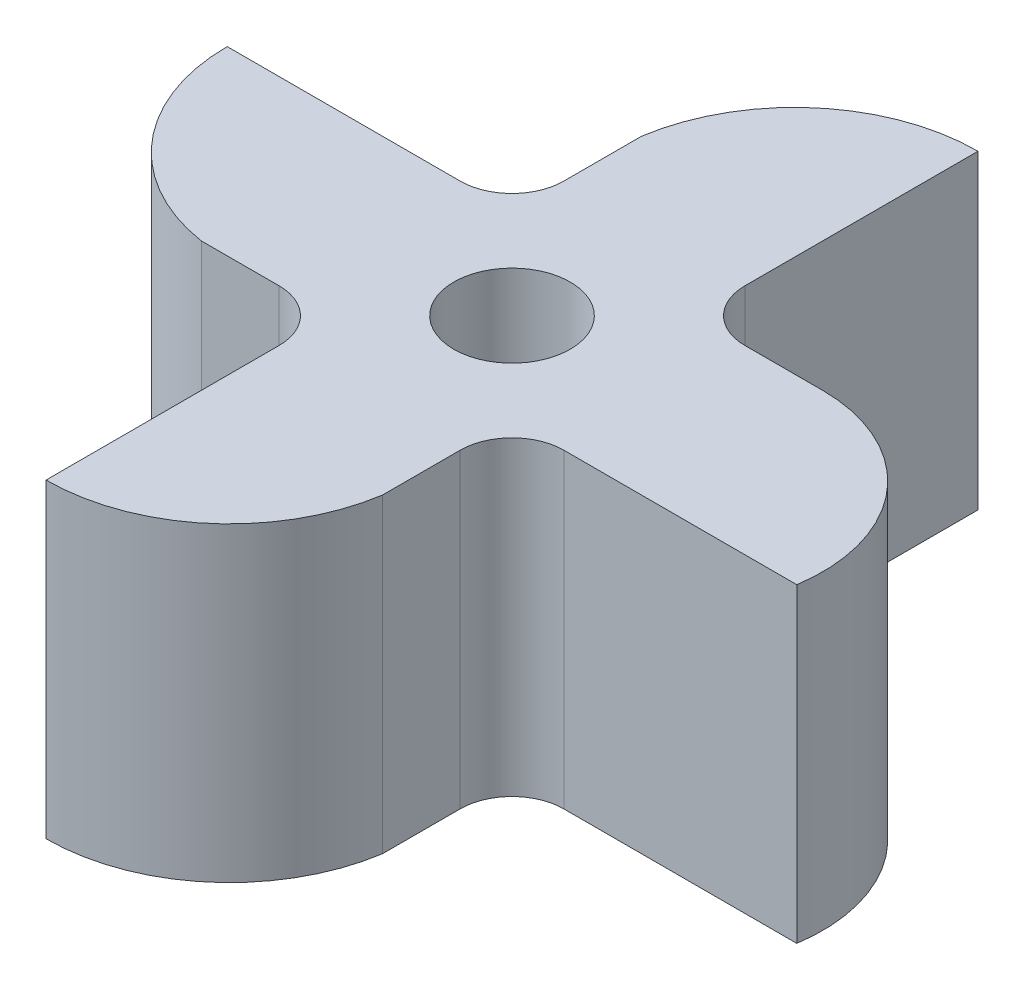
from build123d import *

# Parameters (mm, degrees)
SKETCH1_R           = 2.25
BOSS_EXTRUDE1_DEPTH = 12


with BuildPart() as part:
    # Sketch1 → Boss-Extrude1 (new body)
    with BuildSketch(Plane(origin=(0, 0, 0), x_dir=(1, 0, 0), z_dir=(0, 1, 0))):
        with BuildLine():
            Line((3.5, 5.5), (3.5, 14.5))
            ThreePointArc((3.5, 14.5), (-1.109772229, 12.794734267), (-3.5, 8.5))
            Line((-3.5, 8.5), (-3.5, 5.5))
            ThreePointArc((-3.5, 5.5), (-4.085786438, 4.085786438), (-5.5, 3.5))
            Line((-5.5, 3.5), (-14.5, 3.5))
            ThreePointArc((-14.5, 3.5), (-12.794734267, -1.109772229), (-8.5, -3.5))
            Line((-8.5, -3.5), (-5.5, -3.5))
            ThreePointArc((-5.5, -3.5), (-4.085786438, -4.085786438), (-3.5, -5.5))
            Line((-3.5, -5.5), (-3.5, -14.5))
            ThreePointArc((-3.5, -14.5), (1.109772229, -12.794734267), (3.5, -8.5))
            Line((3.5, -8.5), (3.5, -5.5))
            ThreePointArc((3.5, -5.5), (4.085786438, -4.085786438), (5.5, -3.5))
            Line((5.5, -3.5), (14.5, -3.5))
            ThreePointArc((14.5, -3.5), (13.109772229, 1.379804767), (8.5, 3.5))
            Line((8.5, 3.5), (5.5, 3.5))
            ThreePointArc((5.5, 3.5), (4.085786438, 4.085786438), (3.5, 5.5))
        make_face()
        Circle(SKETCH1_R, mode=Mode.SUBTRACT)
    extrude(amount=BOSS_EXTRUDE1_DEPTH)


solid = part.part
